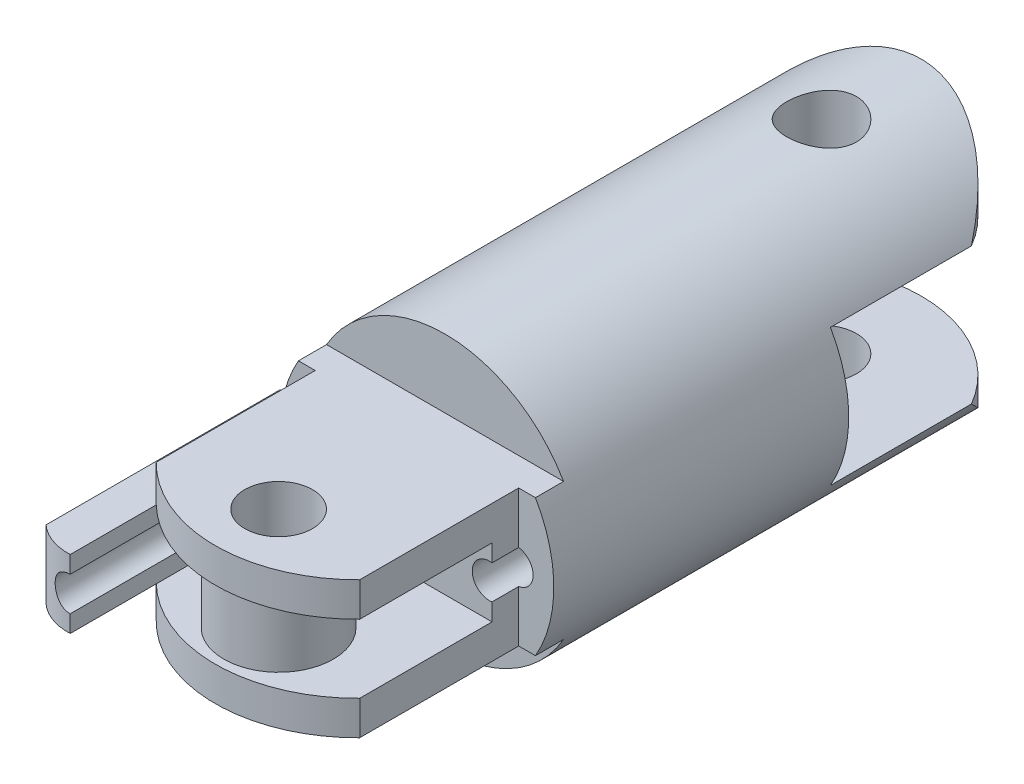
from build123d import *
from build123d.topology import SkipClean

# Parameters (mm, degrees)
SKETCH2_R                       = 10
PHALANGE_LENGTH_DEPTH           = 23.5
BOSS_EXTRUDE3_DEPTH             = 5
BOSS_EXTRUDE4_DEPTH             = 5
BOSS_EXTRUDE4_DEPTH_BACK        = 5
CUT_EXTRUDE2_START              = -15.3025
CUT_EXTRUDE2_DEPTH              = 15.3025
SKETCH7_R                       = 1.65
CUT_EXTRUDE3_DEPTH              = 10
CUT_EXTRUDE4_DEPTH              = 2.5
CUT_EXTRUDE4_DEPTH_BACK         = 2.5
CUT_EXTRUDE7_REACH              = 44.831
SKETCH4_R                       = 1.65
CUT_EXTRUDE7_DIRECTION_2_REACH  = 44.831
CUT_EXTRUDE_THIN1_START         = 23.5
CUT_EXTRUDE_THIN1_DEPTH         = 10.361670454
BOSS_EXTRUDE5_REACH             = 44.021
SKETCH9_R                       = 4
SKETCH9_R_2                     = 1.65
CUT_EXTRUDE8_REACH              = 43.299
SKETCH10_R                      = 1.25
CUT_EXTRUDE9_START              = -4
CUT_EXTRUDE9_DEPTH              = 4
CUT_EXTRUDE10_REACH             = 44.021
CUT_EXTRUDE10_DIRECTION_2_REACH = 44.021
CUT_EXTRUDE11_START             = -10
CUT_EXTRUDE11_OUTLINE_W         = 2.565773848
CUT_EXTRUDE11_OUTLINE_H         = 11.6166929
CUT_EXTRUDE11_DEPTH             = 10
BOSS_EXTRUDE7_REACH             = 41.664
CUT_EXTRUDE12_REACH             = 43.299
SKETCH10_2_R                    = 1.25
CUT_EXTRUDE12_DIRECTION_2_REACH = 43.299
SKETCH17_R                      = 1.25
SKETCH17_W                      = 2.42123439
SKETCH17_H                      = 5
CUT_EXTRUDE14_DEPTH             = 16.148519
SCALE1_SCALE                    = 0.666666667
CUT_EXTRUDE15_START             = -10
SKETCH18_R                      = 1.65
CUT_EXTRUDE15_DEPTH             = 13.333338
CUT_EXTRUDE16_START             = -3.333333
SKETCH19_R                      = 1.7
CUT_EXTRUDE16_DEPTH             = 13.333338


# Read off the part's stored shape, not the designer's step: Cut-Extrude-Thin1, Cut-Extrude11
with BuildPart() as part:
    # Sketch2 → Phalange Length (new body)
    with BuildSketch(Plane.XY):
        Circle(SKETCH2_R)
    extrude(amount=PHALANGE_LENGTH_DEPTH)

    # Sketch3 → Boss-Extrude3 (add)
    with BuildSketch(Plane(origin=(0, -10, 0), x_dir=(-1, 0, 0), z_dir=(0, -1, 0))):
        with BuildLine():
            Line((-10, 5.302499701), (-10, 0))
            Line((-10, 0), (10, 0))
            Line((10, 0), (10, 5.302499701))
            ThreePointArc((10, 5.302499701), (0, 15.302499701), (-10, 5.302499701))
        make_face()
    boss_extrude3 = extrude(amount=-BOSS_EXTRUDE3_DEPTH)

    # Mirror1: Boss-Extrude3 across plane
    add(boss_extrude3.mirror(Plane.ZX))

    # Sketch5 → Boss-Extrude4 (add, two sides: drawn at the far end of the back side and taken through both)
    with BuildSketch(Plane(origin=(0, 0, 0), x_dir=(1, 0, 0), z_dir=(0, 1, 0)).offset(-BOSS_EXTRUDE4_DEPTH_BACK)):
        with BuildLine():
            Line((-10, -29.283157911), (-10, -23.5))
            Line((-10, -23.5), (10, -23.5))
            Line((10, -23.5), (10, -29.283157911))
            ThreePointArc((10, -29.283157911), (0, -38.851984156), (-10, -29.283157911))
        make_face()
    extrude(amount=BOSS_EXTRUDE4_DEPTH + BOSS_EXTRUDE4_DEPTH_BACK)

    # Sketch6 → Cut-Extrude2 (cut)
    with SkipClean():  # the faces are left unmerged after this step: merging them gives an invalid solid
        with BuildSketch(Plane.XY.offset(CUT_EXTRUDE2_START)):
            with BuildLine():
                ThreePointArc((0, 10), (5, 8.660254038), (8.660254038, 5))
                Line((8.660254038, 5), (10, 5))
                Line((10, 5), (10, 10))
                Line((10, 10), (0, 10))
            make_face()
            with BuildLine():
                Line((10, -5), (8.660254038, -5))
                ThreePointArc((8.660254038, -5), (5, -8.660254038), (0, -10))
                Line((0, -10), (10, -10))
                Line((10, -10), (10, -5))
            make_face()
            with BuildLine():
                ThreePointArc((-8.660254038, 5), (-5, 8.660254038), (0, 10))
                Line((0, 10), (-10, 10))
                Line((-10, 10), (-10, 5))
                Line((-10, 5), (-8.660254038, 5))
            make_face()
            with BuildLine():
                Line((-10, -10), (0, -10))
                ThreePointArc((0, -10), (-5, -8.660254038), (-8.660254038, -5))
                Line((-8.660254038, -5), (-10, -5))
                Line((-10, -5), (-10, -10))
            make_face()
        extrude(amount=CUT_EXTRUDE2_DEPTH, mode=Mode.SUBTRACT)

    # Sketch7 → Cut-Extrude3 (cut)
    with SkipClean():  # the faces are left unmerged after this step: merging them gives an invalid solid
        with BuildSketch(Plane(origin=(0, 5, 0), x_dir=(1, 0, 0), z_dir=(0, 1, 0))):
            with Locations(Location((0, -31.661984156, 0), (0, 0, 270))):
                Circle(SKETCH7_R)
        extrude(amount=-CUT_EXTRUDE3_DEPTH, mode=Mode.SUBTRACT)

    # Sketch5<2> → Cut-Extrude4 (cut, two sides: drawn at the far end of the back side and taken through both)
    with BuildSketch(Plane(origin=(0, 0, 0), x_dir=(1, 0, 0), z_dir=(0, 1, 0)).offset(-CUT_EXTRUDE4_DEPTH_BACK)):
        with BuildLine():
            Line((-10, -29.283157911), (-10, -23.5))
            Line((-10, -23.5), (10, -23.5))
            Line((10, -23.5), (10, -29.283157911))
            ThreePointArc((10, -29.283157911), (0, -38.851984156), (-10, -29.283157911))
        make_face()
    extrude(amount=CUT_EXTRUDE4_DEPTH + CUT_EXTRUDE4_DEPTH_BACK, mode=Mode.SUBTRACT)

    # Sketch4 → Cut-Extrude7 (cut, up to next)
    with BuildSketch(Plane(origin=(0, -5, 0), x_dir=(1, 0, 0), z_dir=(0, 1, 0)), mode=Mode.PRIVATE) as cut_extrude7_sk1:
        with Locations(Location((0, 8.010159673, 0), (0, 0, 270))):
            Circle(SKETCH4_R)
    cut_extrude7_tool1 = extrude(cut_extrude7_sk1.sketch, amount=-CUT_EXTRUDE7_REACH, mode=Mode.PRIVATE) & part.part
    add(cut_extrude7_tool1.solids().sort_by_distance((0, -5, -8.01016))[0], mode=Mode.SUBTRACT)

    # Sketch4 → Cut-Extrude7 direction 2 (cut, up to next)
    with BuildSketch(Plane(origin=(0, -5, 0), x_dir=(1, 0, 0), z_dir=(0, 1, 0)), mode=Mode.PRIVATE) as cut_extrude7_direction_2_sk1:
        with Locations(Location((0, 8.010159673, 0), (0, 0, 270))):
            Circle(SKETCH4_R)
    cut_extrude7_direction_2_tool1 = extrude(cut_extrude7_direction_2_sk1.sketch, amount=CUT_EXTRUDE7_DIRECTION_2_REACH, mode=Mode.PRIVATE) & part.part
    add(cut_extrude7_direction_2_tool1.solids().sort_by_distance((0, -5, -8.01016))[0], mode=Mode.SUBTRACT)

    # Cut-Extrude-Thin1 outline → Cut-Extrude-Thin1 (cut)
    with SkipClean():  # the faces are left unmerged after this step: merging them gives an invalid solid
        with BuildSketch(Plane.XY.offset(CUT_EXTRUDE_THIN1_START)):
            with BuildLine():
                ThreePointArc((8.660254038, 5), (9.256147934, 3.78466979), (9.682458366, 2.5))
                Line((9.682458366, 2.5), (10, 2.5))
                Line((10, 2.5), (10, 5))
                Line((10, 5), (8.660254038, 5))
            make_face()
            with BuildLine():
                Line((10, -2.5), (9.682458366, -2.5))
                ThreePointArc((9.682458366, -2.5), (9.256147934, -3.78466979), (8.660254038, -5))
                Line((8.660254038, -5), (10, -5))
                Line((10, -5), (10, -2.5))
            make_face()
            with BuildLine():
                Line((-10, 2.5), (-9.682458366, 2.5))
                ThreePointArc((-9.682458366, 2.5), (-9.256147934, 3.78466979), (-8.660254038, 5))
                Line((-8.660254038, 5), (-10, 5))
                Line((-10, 5), (-10, 2.5))
            make_face()
            with BuildLine():
                ThreePointArc((-8.660254038, -5), (-9.256147934, -3.78466979), (-9.682458366, -2.5))
                Line((-9.682458366, -2.5), (-10, -2.5))
                Line((-10, -2.5), (-10, -5))
                Line((-10, -5), (-8.660254038, -5))
            make_face()
        extrude(amount=CUT_EXTRUDE_THIN1_DEPTH, mode=Mode.SUBTRACT)

    # Sketch9 → Boss-Extrude5 (add, up to next)
    with BuildSketch(Plane.XZ.offset(-2.5), mode=Mode.PRIVATE) as boss_extrude5_sk1:
        with Locations(Location((0, 31.661984156, 0), (0, 0, 90))):
            Circle(SKETCH9_R)
        with Locations(Location((0, 31.661984156, 0), (0, 0, 90))):
            Circle(SKETCH9_R_2, mode=Mode.SUBTRACT)
    boss_extrude5_tool1 = extrude(boss_extrude5_sk1.sketch, amount=BOSS_EXTRUDE5_REACH, mode=Mode.PRIVATE) - part.part
    add(boss_extrude5_tool1.solids().sort_by_distance((0, 2.5, 27.775121))[0])

    # Sketch10 → Cut-Extrude8 (cut, up to next)
    with BuildSketch(Plane.XY.offset(23.5), mode=Mode.PRIVATE) as cut_extrude8_sk1:
        with Locations((7.239961745, 0)):
            Circle(SKETCH10_R)
    cut_extrude8_tool1 = extrude(cut_extrude8_sk1.sketch, amount=-CUT_EXTRUDE8_REACH, mode=Mode.PRIVATE) & part.part
    # Sketch10 → Cut-Extrude8 (cut, up to next)
    with BuildSketch(Plane.XY.offset(23.5), mode=Mode.PRIVATE) as cut_extrude8_sk2:
        with Locations((-7.239961745, 0)):
            Circle(SKETCH10_R)
    cut_extrude8_tool2 = extrude(cut_extrude8_sk2.sketch, amount=-CUT_EXTRUDE8_REACH, mode=Mode.PRIVATE) & part.part
    add(cut_extrude8_tool1.solids().sort_by_distance((7.239962, 0, 23.5))[0], mode=Mode.SUBTRACT)
    add(cut_extrude8_tool2.solids().sort_by_distance((-7.239962, 0, 23.5))[0], mode=Mode.SUBTRACT)

    # Sketch11 → Cut-Extrude9 (cut)
    with SkipClean():  # the faces are left unmerged after this step: merging them gives an invalid solid
        with BuildSketch(Plane.XY.offset(23.5).offset(CUT_EXTRUDE9_START)):
            with BuildLine():
                ThreePointArc((8.660254038, 5), (0, 10), (-8.660254038, 5))
                Line((-8.660254038, 5), (8.660254038, 5))
            make_face()
            with BuildLine():
                Line((8.660254038, -5), (-8.660254038, -5))
                ThreePointArc((-8.660254038, -5), (0, -10), (8.660254038, -5))
            make_face()
        extrude(amount=CUT_EXTRUDE9_DEPTH, mode=Mode.SUBTRACT)

    # Sketch12 → Cut-Extrude10 (cut, up to next)
    with BuildSketch(Plane.XZ.offset(-2.5), mode=Mode.PRIVATE) as cut_extrude10_sk1:
        with BuildLine():
            Line((-10.033719202, 38.851984156), (-10.033719202, 31.664892021))
            Line((-10.033719202, 31.664892021), (-8.660254038, 31.664892021))
            ThreePointArc((-8.660254038, 31.664892021), (0, 36.290740593), (8.660254038, 31.664892021))
            Line((8.660254038, 31.664892021), (10.033719202, 31.664892021))
            Line((10.033719202, 31.664892021), (10.033719202, 38.851984156))
            Line((10.033719202, 38.851984156), (-10.033719202, 38.851984156))
        make_face()
    cut_extrude10_tool1 = extrude(cut_extrude10_sk1.sketch, amount=CUT_EXTRUDE10_REACH, mode=Mode.PRIVATE) & part.part
    add(cut_extrude10_tool1.solids().sort_by_distance((0, 2.5, 36.350279))[0], mode=Mode.SUBTRACT)

    # Sketch12 → Cut-Extrude10 direction 2 (cut, up to next)
    with BuildSketch(Plane.XZ.offset(-2.5), mode=Mode.PRIVATE) as cut_extrude10_direction_2_sk1:
        with BuildLine():
            Line((-10.033719202, 38.851984156), (-10.033719202, 31.664892021))
            Line((-10.033719202, 31.664892021), (-8.660254038, 31.664892021))
            ThreePointArc((-8.660254038, 31.664892021), (0, 36.290740593), (8.660254038, 31.664892021))
            Line((8.660254038, 31.664892021), (10.033719202, 31.664892021))
            Line((10.033719202, 31.664892021), (10.033719202, 38.851984156))
            Line((10.033719202, 38.851984156), (-10.033719202, 38.851984156))
        make_face()
    cut_extrude10_direction_2_tool1 = extrude(cut_extrude10_direction_2_sk1.sketch, amount=-CUT_EXTRUDE10_DIRECTION_2_REACH, mode=Mode.PRIVATE) & part.part
    add(cut_extrude10_direction_2_tool1.solids().sort_by_distance((0, 2.5, 36.350279))[0], mode=Mode.SUBTRACT)

    # Cut-Extrude11 outline → Cut-Extrude11 (cut)
    with BuildSketch(Plane.XZ.offset(5).offset(CUT_EXTRUDE11_START)):
        with Locations((-8.717113076, 27.360571369)):
            Rectangle(CUT_EXTRUDE11_OUTLINE_W, CUT_EXTRUDE11_OUTLINE_H)
        with Locations((8.717113076, 27.360571369)):
            Rectangle(CUT_EXTRUDE11_OUTLINE_W, CUT_EXTRUDE11_OUTLINE_H)
    extrude(amount=CUT_EXTRUDE11_DEPTH, mode=Mode.SUBTRACT)

    # Boss-Extrude7: up to this face of the body (flat: up to its plane)
    boss_extrude7_end = Plane(part.part.faces().sort_by_distance((0, 2.5, 23.696174341))[0])
    # Sketch16 → Boss-Extrude7 (add, up to the picked face)
    with BuildSketch(Plane(origin=(0, -2.5, 0), x_dir=(1, 0, 0), z_dir=(0, 1, 0)), mode=Mode.PRIVATE) as boss_extrude7_sk1:
        with BuildLine():
            Line((-4.818727355, -21.552224919), (-7.434226152, -21.552224919))
            Line((-7.434226152, -21.552224919), (-10, -21.552224919))
            Line((-10, -21.552224919), (-10, -38.658561033))
            ThreePointArc((-10, -38.658561033), (-8.808295471, -39.390817912), (-7.43422564, -39.652145139))
            ThreePointArc((-7.43422564, -39.652145139), (-6.033645007, -39.399721533), (-4.818727355, -38.658561033))
            Line((-4.818727355, -38.658561033), (-4.818727355, -35.109527951))
            ThreePointArc((-4.818727355, -35.109527951), (-6.204248493, -34.242230104), (-7.437080645, -33.168917819))
            Line((-7.437080645, -33.168917819), (-7.434226152, -33.168917819))
            Line((-7.434226152, -33.168917819), (-7.434226152, -23.5))
            Line((-7.434226152, -23.5), (-4.818727355, -23.5))
            Line((-4.818727355, -23.5), (-4.818727355, -21.552224919))
        make_face()
    boss_extrude7_tool1 = split(extrude(boss_extrude7_sk1.sketch, amount=BOSS_EXTRUDE7_REACH, mode=Mode.PRIVATE), bisect_by=boss_extrude7_end, keep=Keep.BOTH, mode=Mode.PRIVATE)
    # Sketch16 → Boss-Extrude7 (add, up to the picked face)
    with BuildSketch(Plane(origin=(0, -2.5, 0), x_dir=(1, 0, 0), z_dir=(0, 1, 0)), mode=Mode.PRIVATE) as boss_extrude7_sk2:
        with BuildLine():
            Line((-4.818727355, -35.109527951), (-4.818727355, -23.5))
            Line((-4.818727355, -23.5), (-7.434226152, -23.5))
            Line((-7.434226152, -23.5), (-7.434226152, -33.168917819))
            Line((-7.434226152, -33.168917819), (-7.437080645, -33.168917819))
            ThreePointArc((-7.437080645, -33.168917819), (-6.204248493, -34.242230104), (-4.818727355, -35.109527951))
        make_face()
    boss_extrude7_tool2 = split(extrude(boss_extrude7_sk2.sketch, amount=BOSS_EXTRUDE7_REACH, mode=Mode.PRIVATE), bisect_by=boss_extrude7_end, keep=Keep.BOTH, mode=Mode.PRIVATE)
    add(boss_extrude7_tool1.solids().sort_by(Axis((-7.989429, -2.5, 31.133344), (0, 1, 0)))[0])
    add(boss_extrude7_tool2.solids().sort_by(Axis((-6.08748, -2.5, 28.8879), (0, 1, 0)))[0])

    # Sketch10<2> → Cut-Extrude12 (cut, up to next)
    with BuildSketch(Plane.XY.offset(23.5), mode=Mode.PRIVATE) as cut_extrude12_sk1:
        with Locations((-7.239961745, 0)):
            Circle(SKETCH10_2_R)
    cut_extrude12_tool1 = extrude(cut_extrude12_sk1.sketch, amount=CUT_EXTRUDE12_REACH, mode=Mode.PRIVATE) & part.part
    add(cut_extrude12_tool1.solids().sort_by_distance((-7.239962, 0, 23.5))[0], mode=Mode.SUBTRACT)

    # Sketch10<2> → Cut-Extrude12 direction 2 (cut, up to next)
    with BuildSketch(Plane.XY.offset(23.5), mode=Mode.PRIVATE) as cut_extrude12_direction_2_sk1:
        with Locations((-7.239961745, 0)):
            Circle(SKETCH10_2_R)
    cut_extrude12_direction_2_tool1 = extrude(cut_extrude12_direction_2_sk1.sketch, amount=-CUT_EXTRUDE12_DIRECTION_2_REACH, mode=Mode.PRIVATE) & part.part
    add(cut_extrude12_direction_2_tool1.solids().sort_by_distance((-7.239962, 0, 23.5))[0], mode=Mode.SUBTRACT)

    # Sketch17 → Cut-Extrude14 (cut)
    with SkipClean():  # the faces are left unmerged after this step: merging them gives an invalid solid
        with BuildSketch(Plane.XY.offset(23.5)):
            with Locations((-7.239961745, 0)):
                Circle(SKETCH17_R)
            with Locations((-6.02934455, 0)):
                Rectangle(SKETCH17_W, SKETCH17_H)
        extrude(amount=CUT_EXTRUDE14_DEPTH, mode=Mode.SUBTRACT)


with BuildPart() as part_1:
    # Scale1: scaled about (-0.185364754, -1.7e-07, 10.183125928)
    add(part.part.scale(SCALE1_SCALE).moved(Location((-0.061788251, -5.7e-08, 3.394375309))))

    # Sketch18 → Cut-Extrude15 (cut)
    with BuildSketch(Plane(origin=(0, 3.333328693, 0), x_dir=(1, 0, 0), z_dir=(0, 1, 0)).offset(CUT_EXTRUDE15_START)):
        with Locations(Location((-0.061797352, -24.502530762, 0), (0, 0, 270))):
            Circle(SKETCH18_R)
    extrude(amount=CUT_EXTRUDE15_DEPTH, mode=Mode.SUBTRACT)

    # Sketch19 → Cut-Extrude16 (cut)
    with BuildSketch(Plane(origin=(0, -3.333337974, 0), x_dir=(1, 0, 0), z_dir=(0, 1, 0)).offset(CUT_EXTRUDE16_START)):
        with Locations(Location((-0.061797352, 1.945565124, 0), (0, 0, 90))):
            Circle(SKETCH19_R)
    extrude(amount=CUT_EXTRUDE16_DEPTH, mode=Mode.SUBTRACT)


solid = part_1.part
